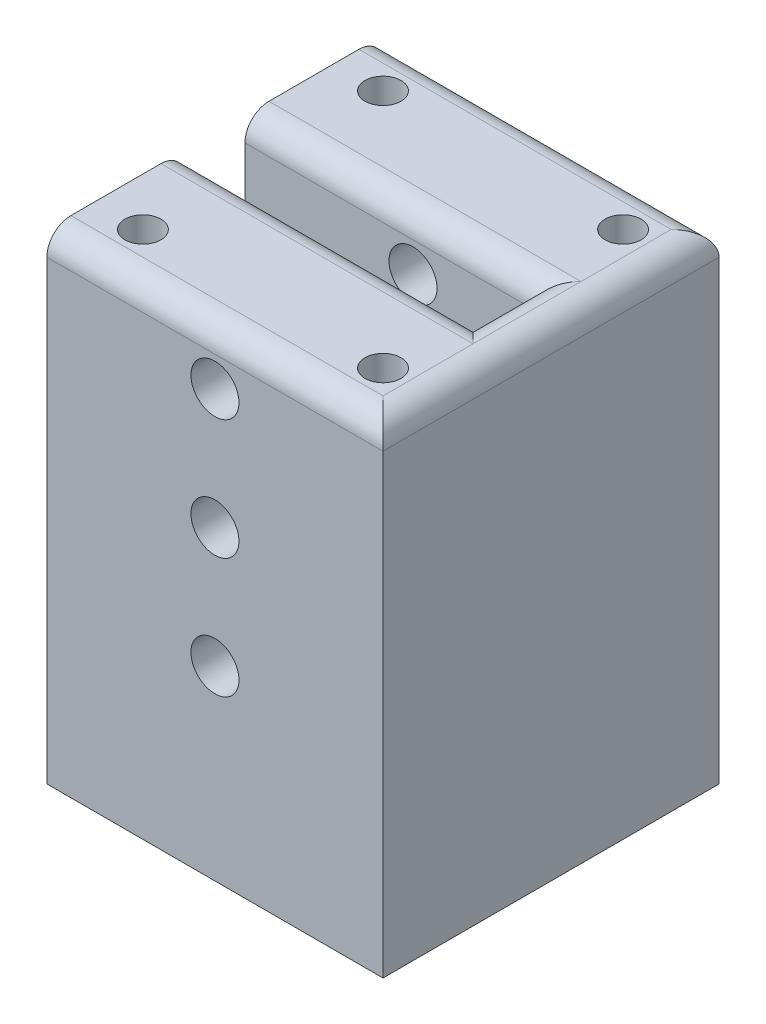
from build123d import *

# Parameters (mm, degrees)
SKIZZE2_W                       = 28
SKIZZE2_H                       = 28
SKIZZE2_R                       = 1.5
AUFSATZ_LINEAR_AUSTRAGEN1_DEPTH = 40
SKIZZE3_W                       = 24
SKIZZE3_H                       = 5
SCHNITT_LINEAR_AUSTRAGEN1_DEPTH = 30
F_4_0_4_DURCHMESSER_BOHRUNG1_D  = 4
VERRUNDUNG1_R                   = 2


with BuildPart() as part:
    # Skizze2 → Aufsatz-Linear austragen1 (new body)
    with BuildSketch(Plane(origin=(0, 0, 0), x_dir=(1, 0, 0), z_dir=(0, 1, 0))):
        with Locations((-10.243240712, -0.002346974)):
            Rectangle(SKIZZE2_W, SKIZZE2_H)
        with Locations(Location((-20.243240712, 9.997653026, 0), (0, 0, 270))):
            Circle(SKIZZE2_R, mode=Mode.SUBTRACT)
        with Locations(Location((-0.243240712, 9.997653026, 0), (0, 0, 270))):
            Circle(SKIZZE2_R, mode=Mode.SUBTRACT)
        with Locations(Location((-20.243240712, -10.002346974, 0), (0, 0, 270))):
            Circle(SKIZZE2_R, mode=Mode.SUBTRACT)
        with Locations(Location((-0.243240712, -10.002346974, 0), (0, 0, 270))):
            Circle(SKIZZE2_R, mode=Mode.SUBTRACT)
    extrude(amount=AUFSATZ_LINEAR_AUSTRAGEN1_DEPTH)

    # Skizze3 → Schnitt-Linear austragen1 (cut)
    with BuildSketch(Plane(origin=(0, 40, 0), x_dir=(1, 0, 0), z_dir=(0, 1, 0))):
        with Locations((-12.243240712, -0.002346974)):
            Rectangle(SKIZZE3_W, SKIZZE3_H)
    extrude(amount=-SCHNITT_LINEAR_AUSTRAGEN1_DEPTH, mode=Mode.SUBTRACT)

    # Ø4.0 (4) Durchmesser Bohrung1 (through all)
    with Locations(Plane.XY.offset(14.002346974)):
        with Locations((-10.243240712, 15.5), (-10.243240712, 35.5), (-10.243240712, 25.5)):
            Hole(F_4_0_4_DURCHMESSER_BOHRUNG1_D / 2)

    # Verrundung1
    verrundung1_edges = [part.edges().sort_by_distance(p)[0] for p in [
        (3.756759288, 40, 0.002346974),
        (-10.243240712, 40, -13.997653026),
        (-12.243240712, 40, 2.502346974),
        (-0.243240712, 40, 0.002346974),
        (-12.243240712, 40, -2.497653026),
        (-10.243240712, 40, 14.002346974),
    ]]
    fillet(verrundung1_edges, radius=VERRUNDUNG1_R - 0.0001)  # a hair under: the kernel refuses the full size


solid = part.part
